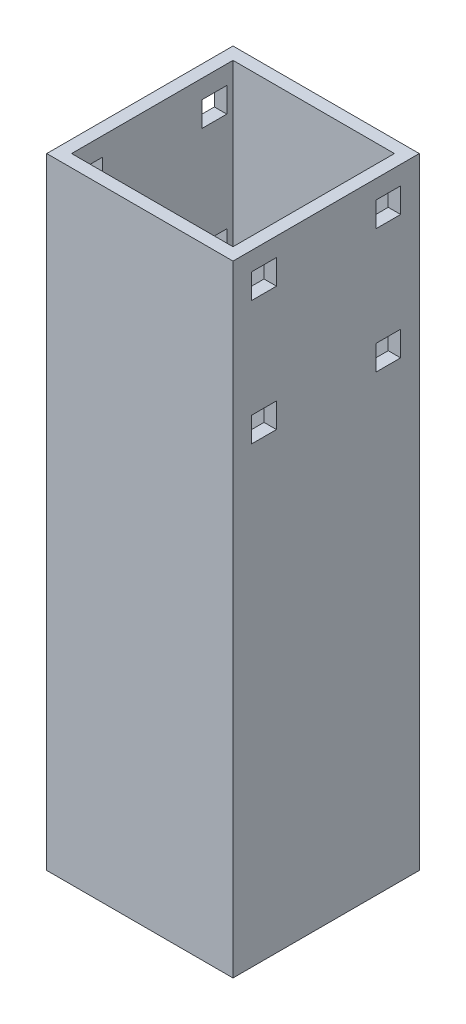
from build123d import *

# Parameters (mm, degrees)
SKETCH1_W           = 30
SKETCH1_H           = 30
SKETCH1_W_2         = 12
SKETCH1_H_2         = 26
BOSS_EXTRUDE2_DEPTH = 100
SKETCH2_W           = 4
SKETCH2_H           = 4
CUT_EXTRUDE1_DEPTH  = 51
SKETCH3_W           = 7
SKETCH3_H           = 26
CUT_EXTRUDE2_DEPTH  = 70


with BuildPart() as part:
    # Sketch1 → Boss-Extrude2 (new body)
    with BuildSketch(Plane(origin=(0, 0, 0), x_dir=(1, 0, 0), z_dir=(0, 1, 0))):
        Rectangle(SKETCH1_W, SKETCH1_H)
        Rectangle(SKETCH1_W_2, SKETCH1_H_2, mode=Mode.SUBTRACT)
    extrude(amount=BOSS_EXTRUDE2_DEPTH)

    # Sketch2 → Cut-Extrude1 (cut)
    with BuildSketch(Plane(origin=(15, 0, 0), x_dir=(0, 0, -1), z_dir=(1, 0, 0))):
        with Locations((-10, 95)):
            Rectangle(SKETCH2_W, SKETCH2_H)
        with Locations((10, 95)):
            Rectangle(SKETCH2_W, SKETCH2_H)
        with Locations((-10, 75)):
            Rectangle(SKETCH2_W, SKETCH2_H)
        with Locations((10, 75)):
            Rectangle(SKETCH2_W, SKETCH2_H)
    extrude(amount=-CUT_EXTRUDE1_DEPTH, mode=Mode.SUBTRACT)

    # Sketch3 → Cut-Extrude2 (cut)
    with BuildSketch(Plane(origin=(0, 100, 0), x_dir=(1, 0, 0), z_dir=(0, 1, 0))):
        with Locations((-9.5, 0)):
            Rectangle(SKETCH3_W, SKETCH3_H)
        with Locations((9.5, 0)):
            Rectangle(SKETCH3_W, SKETCH3_H)
    extrude(amount=-CUT_EXTRUDE2_DEPTH, mode=Mode.SUBTRACT)


solid = part.part
